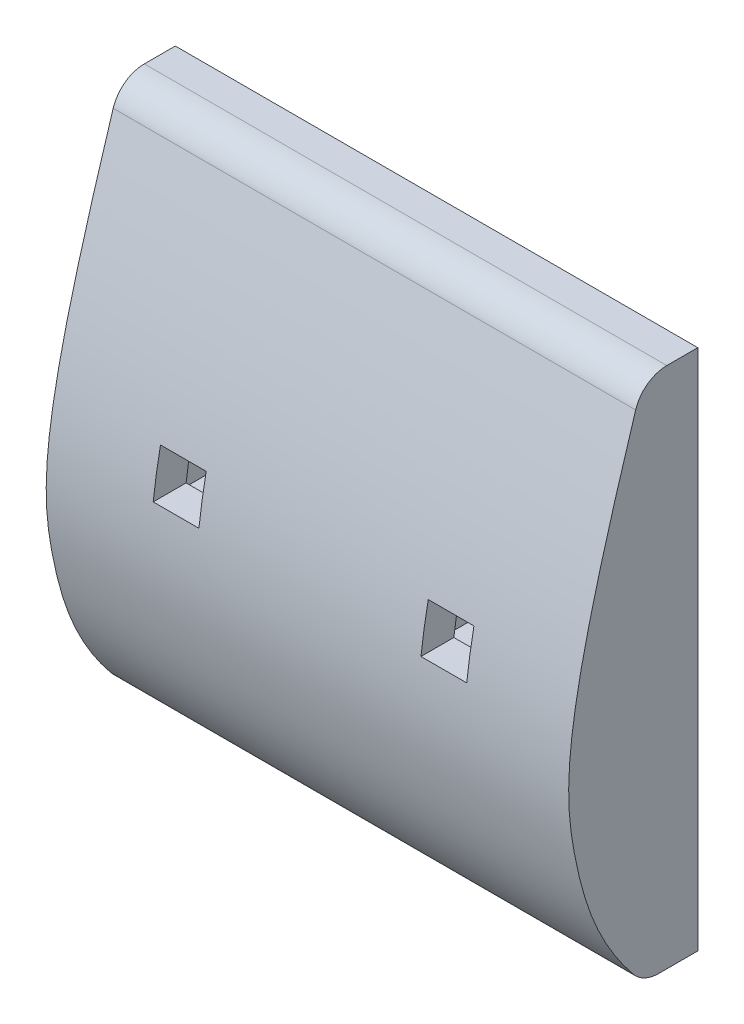
from build123d import *

# Parameters (mm, degrees)
SKETCH_1_W          = 20
SKETCH_1_H          = 80
EXTRUDE_1_DEPTH     = 80
CUT_EXTRUDE_1_DEPTH = 80
FILLET_1_R          = 5
SHELL_START         = 5
SHELL_3_DEPTH       = 70
SKETCH_3_W          = 7
SKETCH_3_H          = 7
CUT_EXTRUDE_3_DEPTH = 80
EXTRUDE_2_REACH     = 116.851
SKETCH_5_W          = 27.599035465
SKETCH_5_H          = 14.025739335
CUT_EXTRUDE_4_REACH = 99.033


# Read off the part's stored shape, not the designer's step: 쉘3
with BuildPart() as part:
    # 스케치1 → 보스-돌출1 (new body)
    with BuildSketch(Plane(origin=(0, 0, 0), x_dir=(0, 0, -1), z_dir=(1, 0, 0))):
        with Locations((10, 40)):
            Rectangle(SKETCH_1_W, SKETCH_1_H)
    extrude(amount=EXTRUDE_1_DEPTH)

    # 스케치2 → 컷-돌출1 (cut)
    with BuildSketch(Plane(origin=(80, 0, 0), x_dir=(0, 0, -1), z_dir=(1, 0, 0))):
        with BuildLine():
            Line((11.591590564, 80), (0, 80))
            Line((0, 80), (0, 0))
            Line((0, 0), (11.716359911, 0))
            add(Edge.make_bspline(
                [(11.591590564, 80), (-0.788687354, 41.111711297), (-0.930526633, 26.247395441), (4.911818792, 7.512157383), (11.716359911, 0)],
                knots=[0, 0, 0, 0, 0.618156119, 1, 1, 1, 1], degree=3))
        make_face()
    extrude(amount=-CUT_EXTRUDE_1_DEPTH, mode=Mode.SUBTRACT)

    # 필렛1
    fillet_1_edges = [part.edges().sort_by_distance(p)[0] for p in [
        (40, 0, -11.716359911),
        (40, 80, -11.591590564),
    ]]
    fillet(fillet_1_edges, radius=FILLET_1_R)

    # 쉘3 outline → 쉘3 (cut)
    with BuildSketch(Plane.YZ.offset(SHELL_START)):
        with BuildLine():
            Line((75, -20), (74.999999784, -15.255073686))
            add(Edge.make_bspline(
                [(74.999999784, -15.255073686), (67.829779133, -13.006113736), (61.460626662, -11.089637393), (55.828308111, -9.484643566), (50.869216464, -8.170232316), (46.521341581, -7.124664573), (42.721071813, -6.328318286), (39.413038096, -5.75562944), (36.528279577, -5.38717997), (34.019435823, -5.193621195), (31.801971368, -5.138118071), (29.778808064, -5.199766787), (27.603301228, -5.385408593), (27.354777332, -5.408490332), (27.107693601, -5.433274029), (26.861838696, -5.459730531), (26.617002242, -5.487832823), (26.37297533, -5.51755571), (26.129551021, -5.548875499), (25.886524852, -5.58176968), (25.643695341, -5.616216611), (25.400864489, -5.652195196), (25.157838288, -5.689684571), (24.792721691, -5.74815339), (24.670919935, -5.768015368), (24.548998185, -5.788247154), (24.426932957, -5.808846127), (24.304701052, -5.829809608), (24.182279559, -5.851134857), (24.059645852, -5.872819075), (23.936777592, -5.894859408), (23.813652725, -5.917252938), (23.690249485, -5.939996692), (23.566546391, -5.963087636), (23.380510176, -5.9982402), (23.318417709, -6.010043782), (23.256242285, -6.021932999), (23.19398134, -6.033907425), (23.131632313, -6.045966636), (23.069192642, -6.058110205), (23.006659764, -6.070337707), (22.944031116, -6.082648717), (22.881304137, -6.095042809), (22.818476264, -6.107519557), (22.755544936, -6.120078536), (22.660988915, -6.139039713), (22.629443763, -6.145380547), (22.597871828, -6.151741763), (22.566272805, -6.158123302), (22.534646389, -6.164525103), (22.502992275, -6.170947108), (22.47131016, -6.177389256), (22.439599737, -6.183851489), (22.407860702, -6.190333746), (22.376092751, -6.196835968), (22.344295578, -6.203358095), (22.28064218, -6.216442041), (22.248806222, -6.222999664), (22.216787665, -6.229608787), (22.185173002, -6.236146877), (22.153078028, -6.242800703), (22.121376446, -6.249383567), (22.089482075, -6.256023898), (22.057634411, -6.262666185), (22.025810888, -6.269319179), (21.993971685, -6.275989337), (21.962144136, -6.282671775), (21.421131548, -6.396511112), (20.913058418, -6.507182675), (20.406011367, -6.621904848), (19.899891415, -6.741190042), (19.394589314, -6.865543681), (18.889985152, -6.995466763), (18.385947953, -7.131458412), (17.882335283, -7.274018442), (17.378992852, -7.423649906), (16.875754115, -7.580861664), (16.372439878, -7.746170929), (14.987735061, -8.224441618), (14.105794888, -8.555181627), (13.222026102, -8.915168442), (12.335314555, -9.307325609), (11.444469206, -9.734725562), (10.548267461, -10.200624762), (9.645511658, -10.708471458), (8.735088494, -11.261891437), (7.816023195, -11.864657175), (6.887520219, -12.520645756), (5.94898228, -13.233790964), (4.999999509, -14.008034922)],
                knots=[0.019005596, 0.019005596, 0.019005596, 0.019005596, 0.019005596, 0.019005596, 0.019005596, 0.019005596, 0.019005596, 0.019005596, 0.019005596, 0.019005596, 0.019005596, 0.5, 0.5, 0.5, 0.5, 0.5, 0.5, 0.5, 0.5, 0.5, 0.5, 0.5, 0.5625, 0.5625, 0.5625, 0.5625, 0.5625, 0.5625, 0.5625, 0.5625, 0.5625, 0.5625, 0.5625, 0.59375, 0.59375, 0.59375, 0.59375, 0.59375, 0.59375, 0.59375, 0.59375, 0.59375, 0.59375, 0.59375, 0.609375, 0.609375, 0.609375, 0.609375, 0.609375, 0.609375, 0.609375, 0.609375, 0.609375, 0.609375, 0.609375, 0.6171875, 0.6171875, 0.6171875, 0.6171875, 0.6171875, 0.6171875, 0.6171875, 0.6171875, 0.6171875, 0.6171875, 0.6171875, 0.625, 0.625, 0.625, 0.625, 0.625, 0.625, 0.625, 0.625, 0.625, 0.625, 0.625, 0.75, 0.75, 0.75, 0.75, 0.75, 0.75, 0.75, 0.75, 0.75, 0.75, 0.75, 0.968713852, 0.968713852, 0.968713852, 0.968713852, 0.968713852, 0.968713852, 0.968713852, 0.968713852, 0.968713852, 0.968713852, 0.968713852, 0.968713852, 0.968713852], degree=12))
            Line((4.999999509, -14.008034922), (5, -20))
            Line((5, -20), (75, -20))
        make_face()
    extrude(amount=SHELL_3_DEPTH, mode=Mode.SUBTRACT)

    # 스케치3 → 컷-돌출3 (cut)
    with BuildSketch(Plane.XY):
        with Locations((19.5, 40.741655041)):
            Rectangle(SKETCH_3_W, SKETCH_3_H)
        with Locations((60.5, 40.741655041)):
            Rectangle(SKETCH_3_W, SKETCH_3_H)
    extrude(amount=-CUT_EXTRUDE_3_DEPTH, mode=Mode.SUBTRACT)

    # 스케치5 → 보스-돌출2 (add, up to next)
    with BuildSketch(Plane(origin=(0, 0, -20), x_dir=(-1, 0, 0), z_dir=(0, 0, -1)), mode=Mode.PRIVATE) as extrude_2_sk1:
        Polygon((-5, 75), (-75, 75), (-75, 48.539865482), (-65.902373449, 48.539865482), (-53.347074528, 48.539865482), (-25.748039063, 48.539865482), (-13.758294148, 48.539865482), (-5, 48.539865482), align=None)
    extrude_2_tool1 = extrude(extrude_2_sk1.sketch, amount=-EXTRUDE_2_REACH, mode=Mode.PRIVATE) - part.part
    # 스케치5 → 보스-돌출2 (add, up to next)
    with BuildSketch(Plane(origin=(0, 0, -20), x_dir=(-1, 0, 0), z_dir=(0, 0, -1)), mode=Mode.PRIVATE) as extrude_2_sk2:
        Polygon((-65.902373449, 48.539865482), (-75, 48.539865482), (-75, 5), (-65.902373449, 5), (-65.902373449, 28.858586093), (-65.902373449, 34.514126147), align=None)
    extrude_2_tool2 = extrude(extrude_2_sk2.sketch, amount=-EXTRUDE_2_REACH, mode=Mode.PRIVATE) - part.part
    # 스케치5 → 보스-돌출2 (add, up to next)
    with BuildSketch(Plane(origin=(0, 0, -20), x_dir=(-1, 0, 0), z_dir=(0, 0, -1)), mode=Mode.PRIVATE) as extrude_2_sk3:
        with Locations((-39.547556796, 41.526995814)):
            Rectangle(SKETCH_5_W, SKETCH_5_H)
    extrude_2_tool3 = extrude(extrude_2_sk3.sketch, amount=-EXTRUDE_2_REACH, mode=Mode.PRIVATE) - part.part
    # 스케치5 → 보스-돌출2 (add, up to next)
    with BuildSketch(Plane(origin=(0, 0, -20), x_dir=(-1, 0, 0), z_dir=(0, 0, -1)), mode=Mode.PRIVATE) as extrude_2_sk4:
        Polygon((-53.347074528, 34.514126147), (-65.902373449, 34.514126147), (-65.902373449, 28.858586093), (-13.758294148, 28.858586093), (-13.758294148, 34.514126147), (-25.748039063, 34.514126147), align=None)
    extrude_2_tool4 = extrude(extrude_2_sk4.sketch, amount=-EXTRUDE_2_REACH, mode=Mode.PRIVATE) - part.part
    # 스케치5 → 보스-돌출2 (add, up to next)
    with BuildSketch(Plane(origin=(0, 0, -20), x_dir=(-1, 0, 0), z_dir=(0, 0, -1)), mode=Mode.PRIVATE) as extrude_2_sk5:
        Polygon((-5, 5), (-5, 48.539865482), (-13.758294148, 48.539865482), (-13.758294148, 34.514126147), (-13.758294148, 28.858586093), (-13.758294148, 5), align=None)
    extrude_2_tool5 = extrude(extrude_2_sk5.sketch, amount=-EXTRUDE_2_REACH, mode=Mode.PRIVATE) - part.part
    add(extrude_2_tool1.solids().sort_by_distance((40, 61.769933, -20))[0])
    add(extrude_2_tool2.solids().sort_by_distance((70.451187, 26.769933, -20))[0])
    add(extrude_2_tool3.solids().sort_by_distance((39.547557, 41.526996, -20))[0])
    add(extrude_2_tool4.solids().sort_by_distance((39.830334, 31.686356, -20))[0])
    add(extrude_2_tool5.solids().sort_by_distance((9.379147, 26.769933, -20))[0])

    # 스케치6 → 컷-돌출4 (cut, up to next)
    with BuildSketch(Plane.XZ.offset(-28.858586093), mode=Mode.PRIVATE) as cut_extrude_4_sk1:
        with BuildLine():
            Line((15.927376618, -20), (23.972864062, -20))
            ThreePointArc((23.972864062, -20), (19.95012034, -15.977256278), (15.927376618, -20))
        make_face()
    cut_extrude_4_tool1 = extrude(cut_extrude_4_sk1.sketch, amount=-CUT_EXTRUDE_4_REACH, mode=Mode.PRIVATE) & part.part
    # 스케치6 → 컷-돌출4 (cut, up to next)
    with BuildSketch(Plane.XZ.offset(-28.858586093), mode=Mode.PRIVATE) as cut_extrude_4_sk2:
        with BuildLine():
            Line((56.070366463, -20), (64.284748666, -20))
            ThreePointArc((64.284748666, -20), (60.177557564, -15.892808898), (56.070366463, -20))
        make_face()
    cut_extrude_4_tool2 = extrude(cut_extrude_4_sk2.sketch, amount=-CUT_EXTRUDE_4_REACH, mode=Mode.PRIVATE) & part.part
    add(cut_extrude_4_tool1.solids().sort_by_distance((19.95012, 28.858586, -18.292695))[0], mode=Mode.SUBTRACT)
    add(cut_extrude_4_tool2.solids().sort_by_distance((60.177558, 28.858586, -18.256854))[0], mode=Mode.SUBTRACT)


solid = part.part
